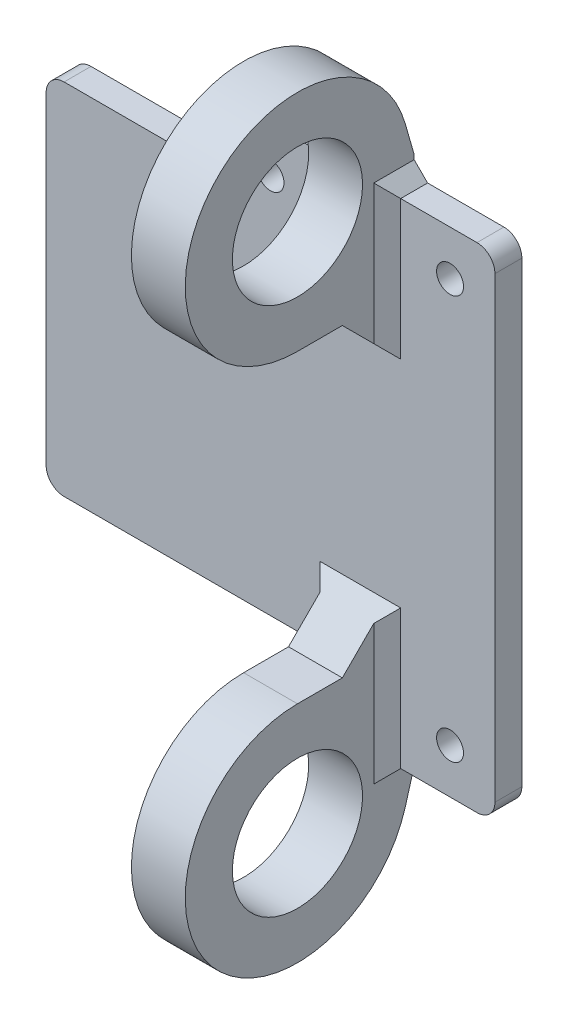
from build123d import *

# Parameters (mm, degrees)
SKETCH1_R           = 1.5
BOSS_EXTRUDE1_DEPTH = 3
FILLET1_R           = 2
BOSS_EXTRUDE2_START = 7
SKETCH2_R           = 7.25
BOSS_EXTRUDE2_DEPTH = 6
CHAMFER1_SIZE       = 2
CHAMFER2_SIZE       = 5
CHAMFER3_SIZE       = 1.5


with BuildPart() as part:
    # Sketch1 → Boss-Extrude1 (new body)
    with BuildSketch(Plane.XY):
        Polygon((10, -27.5), (25, -27.5), (25, 27.5), (-5, 27.5), (-5, 20), (-25, 20), (-25, -20), (10, -20), align=None)
        with Locations((0, 22.5)):
            Circle(SKETCH1_R, mode=Mode.SUBTRACT)
        with Locations((20, 22.5)):
            Circle(SKETCH1_R, mode=Mode.SUBTRACT)
        with Locations((20, -22.5)):
            Circle(SKETCH1_R, mode=Mode.SUBTRACT)
    extrude(amount=BOSS_EXTRUDE1_DEPTH)

    # Fillet1
    fillet1_edges = [part.edges().sort_by_distance(p)[0] for p in [
        (25, 27.5, 1.5),
        (25, -27.5, 1.5),
        (-25, -20, 1.5),
        (-25, 20, 1.5),
    ]]
    fillet(fillet1_edges, radius=FILLET1_R)

    # Sketch2 → Boss-Extrude2 (add)
    # profile 1 of 2: a face of its own
    with BuildSketch(Plane(origin=(0, 0, 0), x_dir=(0, 0, -1), z_dir=(1, 0, 0)).offset(BOSS_EXTRUDE2_START)):
        with BuildLine():
            Line((-13, 17), (0, 17))
            Line((0, 17), (0, 29.500000036))
            Line((0, 29.500000036), (-0.98076924, 32.933379086))
            ThreePointArc((-0.98076924, 32.933379086), (-22.979159247, 37.027707534), (-13, 17))
        make_face()
        with Locations((-13, 29.5)):
            Circle(SKETCH2_R, mode=Mode.SUBTRACT)
    # profile 2 of 2: a face of its own
    with BuildSketch(Plane(origin=(0, 0, 0), x_dir=(0, 0, -1), z_dir=(1, 0, 0)).offset(BOSS_EXTRUDE2_START)):
        with BuildLine():
            Line((0, -29.500000036), (-0.98076924, -32.933379086))
            ThreePointArc((-0.98076924, -32.933379086), (-22.979159247, -37.027707534), (-13, -17))
            Line((-13, -17), (0, -17))
            Line((0, -17), (0, -29.500000036))
        make_face()
        with Locations((-13, -29.5)):
            Circle(SKETCH2_R, mode=Mode.SUBTRACT)
    extrude(amount=BOSS_EXTRUDE2_DEPTH)

    # Chamfer1
    chamfer1_edges = [part.edges().sort_by_distance(p)[0] for p in [
        (-5, 20, 1.5),
        (-5, 27.5, 1.5),
    ]]
    chamfer(chamfer1_edges, length=CHAMFER1_SIZE)

    # Chamfer2
    chamfer2_edges = [part.edges().sort_by_distance(p)[0] for p in [
        (10, -17, 3),
        (10, 17, 3),
    ]]
    chamfer(chamfer2_edges, length=CHAMFER2_SIZE)

    # Chamfer3
    chamfer3_edges = [part.edges().sort_by_distance(p)[0] for p in [
        (7, -20, 1.5),
        (7, -16, 3),
        (13, -27.5, 1.5),
        (13, -19.75, 3),
        (7, 27.5, 1.5),
        (7, 19.75, 3),
        (13, 27.5, 1.5),
        (13, 19.75, 3),
    ]]
    chamfer(chamfer3_edges, length=CHAMFER3_SIZE)


solid = part.part
